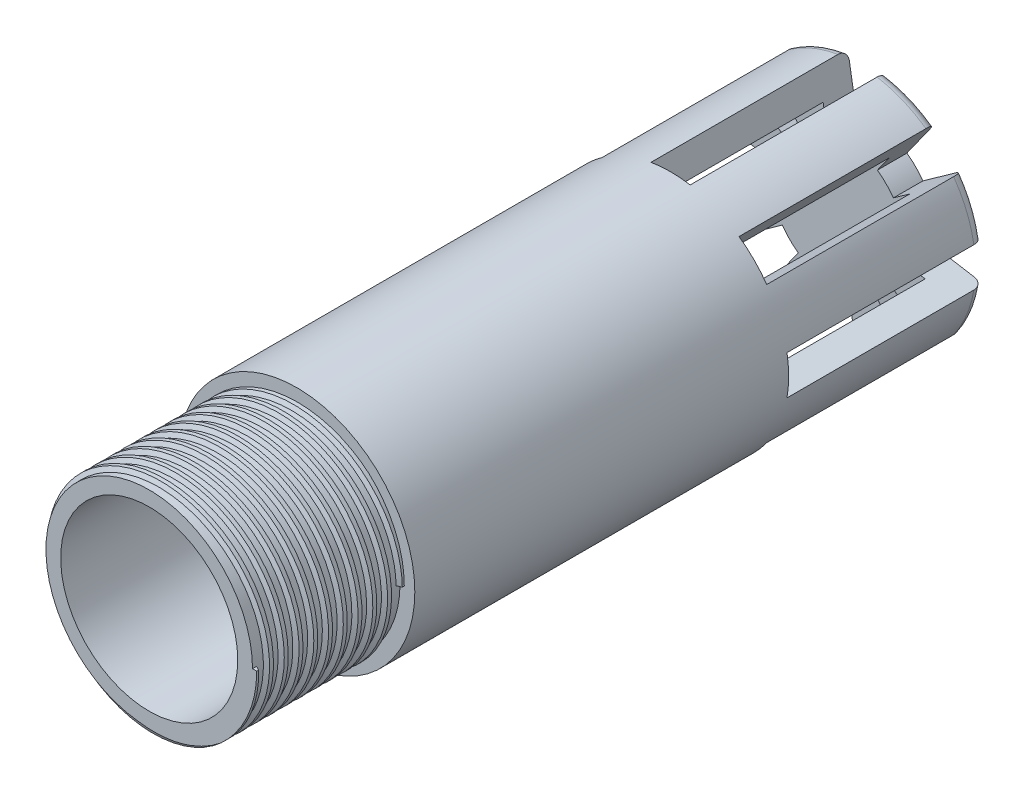
from build123d import *
from build123d.topology import SkipClean

# Parameters (mm, degrees)
SKETCH1_R           = 12
SKETCH1_R_2         = 9
BOSS_EXTRUDE1_DEPTH = 70
BOSS_EXTRUDE2_START = 3
SKETCH2_R           = 12
BOSS_EXTRUDE2_DEPTH = 3
CUT_EXTRUDE1_START  = -15
SKETCH3_R           = 12
SKETCH3_R_2         = 10.5
CUT_EXTRUDE1_DEPTH  = 15
CUT_EXTRUDE3_DEPTH  = 20
SKETCH9_R           = 4.915870375
CUT_EXTRUDE4_DEPTH  = 2
SWEEP1_PITCH        = 1.5
SKETCH12_R          = 11.976916449
CUT_EXTRUDE5_DEPTH  = 1
FILLET1_R           = 1


with BuildPart() as part:
    # Sketch1 → Boss-Extrude1 (new body)
    with BuildSketch(Plane.XY):
        Circle(SKETCH1_R)
        Circle(SKETCH1_R_2, mode=Mode.SUBTRACT)
    extrude(amount=BOSS_EXTRUDE1_DEPTH)

    # Sketch2 → Boss-Extrude2 (add)
    with BuildSketch(Plane(origin=(0, 0, 0), x_dir=(-1, 0, 0), z_dir=(0, 0, -1)).offset(BOSS_EXTRUDE2_START)):
        Circle(SKETCH2_R)
    extrude(amount=-BOSS_EXTRUDE2_DEPTH)

    # Sketch3 → Cut-Extrude1 (cut)
    with BuildSketch(Plane.XY.offset(70).offset(CUT_EXTRUDE1_START)):
        with Locations(Location((0, 0, 0), (0, 0, 180))):
            Circle(SKETCH3_R)
        Circle(SKETCH3_R_2, mode=Mode.SUBTRACT)
    extrude(amount=CUT_EXTRUDE1_DEPTH, mode=Mode.SUBTRACT)

    # Sketch8 → Cut-Extrude3 (cut)
    with SkipClean():  # the faces are left unmerged after this step: merging them gives an invalid solid
        with BuildSketch(Plane(origin=(0, 0, -3), x_dir=(-1, 0, 0), z_dir=(0, 0, -1))):
            with BuildLine():
                Line((-1.151546933, 6.840400981), (-1.992108366, 11.833490789))
                ThreePointArc((-1.992108366, 11.833490789), (0, 12), (1.992108366, 11.833490789))
                Line((1.992108366, 11.833490789), (1.151546933, 6.840400981))
                ThreePointArc((1.151546933, 6.840400981), (0, 6.936652357), (-1.151546933, 6.840400981))
            make_face()
            with BuildLine():
                Line((6.840400981, 1.151546933), (11.833490789, 1.992108366))
                ThreePointArc((11.833490789, 1.992108366), (12, 0), (11.833490789, -1.992108366))
                Line((11.833490789, -1.992108366), (6.840400981, -1.151546933))
                ThreePointArc((6.840400981, -1.151546933), (6.936652357, 0), (6.840400981, 1.151546933))
            make_face()
            with BuildLine():
                Line((4.022627275, 5.651160564), (6.958908248, 9.776174917))
                ThreePointArc((6.958908248, 9.776174917), (8.485281374, 8.485281374), (9.776174917, 6.958908248))
                Line((9.776174917, 6.958908248), (5.651160564, 4.022627275))
                ThreePointArc((5.651160564, 4.022627275), (4.90495392, 4.90495392), (4.022627275, 5.651160564))
            make_face()
            with BuildLine():
                Line((-6.840400981, -1.151546933), (-11.833490789, -1.992108366))
                ThreePointArc((-11.833490789, -1.992108366), (-12, 0), (-11.833490789, 1.992108366))
                Line((-11.833490789, 1.992108366), (-6.840400981, 1.151546933))
                ThreePointArc((-6.840400981, 1.151546933), (-6.936652357, 0), (-6.840400981, -1.151546933))
            make_face()
            with BuildLine():
                Line((1.151546933, -6.840400981), (1.992108366, -11.833490789))
                ThreePointArc((1.992108366, -11.833490789), (0, -12), (-1.992108366, -11.833490789))
                Line((-1.992108366, -11.833490789), (-1.151546933, -6.840400981))
                ThreePointArc((-1.151546933, -6.840400981), (0, -6.936652357), (1.151546933, -6.840400981))
            make_face()
            with BuildLine():
                Line((5.651160564, -4.022627275), (9.776174917, -6.958908248))
                ThreePointArc((9.776174917, -6.958908248), (8.485281374, -8.485281374), (6.958908248, -9.776174917))
                Line((6.958908248, -9.776174917), (4.022627275, -5.651160564))
                ThreePointArc((4.022627275, -5.651160564), (4.90495392, -4.90495392), (5.651160564, -4.022627275))
            make_face()
            with BuildLine():
                Line((-4.022627275, -5.651160564), (-6.958908248, -9.776174917))
                ThreePointArc((-6.958908248, -9.776174917), (-8.485281374, -8.485281374), (-9.776174917, -6.958908248))
                Line((-9.776174917, -6.958908248), (-5.651160564, -4.022627275))
                ThreePointArc((-5.651160564, -4.022627275), (-4.90495392, -4.90495392), (-4.022627275, -5.651160564))
            make_face()
            with BuildLine():
                Line((-5.651160564, 4.022627275), (-9.776174917, 6.958908248))
                ThreePointArc((-9.776174917, 6.958908248), (-8.485281374, 8.485281374), (-6.958908248, 9.776174917))
                Line((-6.958908248, 9.776174917), (-4.022627275, 5.651160564))
                ThreePointArc((-4.022627275, 5.651160564), (-4.90495392, 4.90495392), (-5.651160564, 4.022627275))
            make_face()
        extrude(amount=-CUT_EXTRUDE3_DEPTH, mode=Mode.SUBTRACT)

    # Sketch9 → Cut-Extrude4 (cut)
    with SkipClean():  # the faces are left unmerged after this step: merging them gives an invalid solid
        with BuildSketch(Plane(origin=(0, 0, -3), x_dir=(-1, 0, 0), z_dir=(0, 0, -1))):
            Circle(SKETCH9_R)
        extrude(amount=-CUT_EXTRUDE4_DEPTH, mode=Mode.SUBTRACT)

    # Sweep1: arcs per turn and ends read off the stored shape
    # Sweep1: the profile of Sketch11 profile screwed along a right-hand helix through 10 turns, 8 arcs to a turn; built about Z, then put on its axis
    with SkipClean():  # the faces are left unmerged after this step: merging them gives an invalid solid
        sweep1_z = Axis((0, 0, 0), (0, 0, 1))
        sweep1_corners = [(10.928901384, 0, 0.2), (10.928901384, 0, -0.2), (10.4997, 0, -0.400139892), (10.4997, 0, 0.400139892)]
        with BuildLine(mode=Mode.PRIVATE) as sweep1_profile:
            Line(sweep1_corners[0], sweep1_corners[1])
            Line(sweep1_corners[1], sweep1_corners[2])
            Line(sweep1_corners[2], sweep1_corners[3])
            Line(sweep1_corners[3], sweep1_corners[0])
        sweep1_cap = Face(sweep1_profile.wire())
        sweep1_turn_angles = [0, 22.5, 45, 67.5, 90, 112.5, 135, 157.5, 180, 202.5, 225, 247.5, 270, 292.5, 315, 337.5, 360]
        sweep1_turn_weights = [1, 0.9238795325112867, 1, 0.9238795325112867, 1, 0.9238795325112867, 1, 0.9238795325112867, 1, 0.9238795325112867, 1, 0.9238795325112867, 1, 0.9238795325112867, 1, 0.9238795325112867, 1]
        sweep1_turn_rails = [Edge.make_bspline([Vector(p[0], p[1], 0).rotate(sweep1_z, sweep1_turn_angles[k]) / sweep1_turn_weights[k] + Vector(0, 0, p[2] + SWEEP1_PITCH * sweep1_turn_angles[k] / 360) for k in range(17)], [0, 0, 0, 1, 1, 2, 2, 3, 3, 4, 4, 5, 5, 6, 6, 7, 7, 8, 8, 8], 2, sweep1_turn_weights) for p in sweep1_corners]
        sweep1_turn_sides = [Face.make_surface_from_curves(sweep1_turn_rails[p[0]], sweep1_turn_rails[p[1]]) for p in [(0, 1), (1, 2), (2, 3), (3, 0)]]
        sweep1 = Plane(origin=(0, 0, 70), x_dir=(1, 0, 0), z_dir=(0, 0, -1)) * Solid(Shell([*[p.moved(Location((0, 0, SWEEP1_PITCH * i))) for i in range(10) for p in sweep1_turn_sides], sweep1_cap, sweep1_cap.rotate(sweep1_z, 3600).moved(Location((0, 0, SWEEP1_PITCH * 3600 / 360)))]))
        add(sweep1)

    # Sketch12 → Cut-Extrude5 (cut)
    with SkipClean():  # the faces are left unmerged after this step: merging them gives an invalid solid
        with BuildSketch(Plane.XY.offset(70)):
            Circle(SKETCH12_R)
        extrude(amount=CUT_EXTRUDE5_DEPTH, mode=Mode.SUBTRACT)

    # Fillet1
    fillet1_edges = [part.edges().sort_by_distance(p)[0] for p in [
        (-11.08655439, 4.592201188, -3),
        (-4.592201188, 11.08655439, -3),
        (4.592201188, 11.08655439, -3),
        (11.08655439, 4.592201188, -3),
        (11.08655439, -4.592201188, -3),
        (4.592201188, -11.08655439, -3),
        (-4.592201188, -11.08655439, -3),
        (-11.08655439, -4.592201188, -3),
    ]]
    fillet(fillet1_edges, radius=FILLET1_R)


solid = part.part
